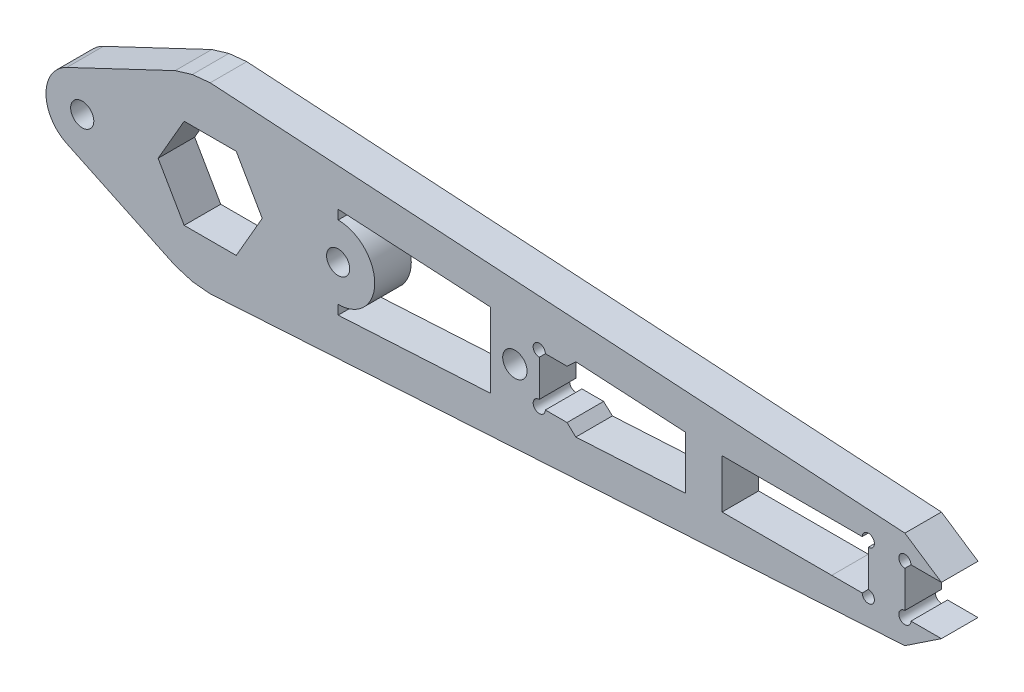
from build123d import *

# Parameters (mm, degrees)
SKETCH_2_R      = 0.999999817
SKETCH_2_R_2    = 0.950000242
EXTRUDE_2_DEPTH = 3


with BuildPart() as part:
    # 草图2 → 凸台-拉伸2 (new body)
    with BuildSketch(Plane.XY):
        with BuildLine():
            Line((57.00000003, 4.00000019), (0, 7.499999832))
            Line((0, 7.499999832), (-1.463177381, 7.355889771))
            Line((-1.463177381, 7.355889771), (-2.870125696, 6.9290963))
            Line((-2.870125696, 6.9290963), (-11.76304094, 2.710484566))
            ThreePointArc((-11.76304094, 2.710484566), (-13.477244136, 0), (-11.76304094, -2.710484566))
            Line((-11.76304094, -2.710484566), (-2.870125696, -6.9290963))
            Line((-2.870125696, -6.9290963), (-1.463177381, -7.355889771))
            Line((-1.463177381, -7.355889771), (0, -7.499999832))
            Line((0, -7.499999832), (57.00000003, -4.00000019))
            Line((57.00000003, -4.00000019), (59.999998659, -2.000000095))
            Line((59.999998659, -2.000000095), (57.500001043, -2.000000095))
            ThreePointArc((57.500001043, -2.000000095), (56.646447675, -2.35355404), (57.00000003, -1.500000013))
            Line((57.00000003, -1.500000013), (57.00000003, 1.500000013))
            ThreePointArc((57.00000003, 1.500000013), (56.646447675, 2.35355404), (57.500001043, 2.000000095))
            Line((57.500001043, 2.000000095), (59.999998659, 2.000000095))
            Line((59.999998659, 2.000000095), (57.00000003, 4.00000019))
        make_face()
        with Locations((25.000000026, 3.041e-06)):
            Circle(SKETCH_2_R, mode=Mode.SUBTRACT)
        with Locations((10.499999852, -1.691e-06)):
            Circle(SKETCH_2_R_2, mode=Mode.SUBTRACT)
        with Locations((-10.499999865, -1.691e-06)):
            Circle(SKETCH_2_R_2, mode=Mode.SUBTRACT)
        with BuildLine():
            Line((41.999999434, 2.002923982), (50.999999046, 2.000000095))
            Line((50.999999046, 2.000000095), (53.500000387, 2.000000095))
            ThreePointArc((53.500000387, 2.000000095), (54.353553756, 2.35355404), (54.000001401, 1.500000013))
            Line((54.000001401, 1.500000013), (54.000001401, -1.500000013))
            ThreePointArc((54.000001401, -1.500000013), (54.353553756, -2.35355404), (53.500000387, -2.000000095))
            Line((53.500000387, -2.000000095), (50.999999046, -2.000000095))
            Line((50.999999046, -2.000000095), (41.999999434, -2.002923982))
            Line((41.999999434, -2.002923982), (41.999999434, 2.002923982))
        make_face(mode=Mode.SUBTRACT)
        with BuildLine():
            Line((27.499999851, 2.000000095), (29.282599688, 2.000000095))
            Line((29.282599688, 2.000000095), (29.999999329, 2.673489275))
            Line((29.999999329, 2.673489275), (39.000000805, 2.170565305))
            Line((39.000000805, 2.170565305), (39.000000805, -2.170565305))
            Line((39.000000805, -2.170565305), (29.999999329, -2.673489275))
            Line((29.999999329, -2.673489275), (29.282599688, -2.000000095))
            Line((29.282599688, -2.000000095), (27.499999851, -2.000000095))
            ThreePointArc((27.499999851, -2.000000095), (26.646446496, -2.353552709), (27.0000007, -1.500000013))
            Line((27.0000007, -1.500000013), (27.0000007, 1.500000013))
            ThreePointArc((27.0000007, 1.500000013), (26.646446496, 2.353552709), (27.499999851, 2.000000095))
        make_face(mode=Mode.SUBTRACT)
        with BuildLine():
            Line((10.499999858, -3.763157874), (10.499999858, -3.000000026))
            ThreePointArc((10.499999858, -3.000000026), (13.499998187, -1.691e-06), (10.499999858, 3.000000026))
            Line((10.499999858, 3.000000026), (10.499999858, 3.763157874))
            Line((10.499999858, 3.763157874), (23.000000045, 3.064652439))
            Line((23.000000045, 3.064652439), (23.000000045, -3.064652439))
            Line((23.000000045, -3.064652439), (10.499999858, -3.763157874))
        make_face(mode=Mode.SUBTRACT)
        Polygon((-4.27239202, 0), (-2.13619601, 3.700000001), (2.13619601, 3.700000001), (4.27239202, 0), (2.13619601, -3.700000001), (-2.13619601, -3.700000001), align=None, mode=Mode.SUBTRACT)
    extrude(amount=EXTRUDE_2_DEPTH)


solid = part.part
